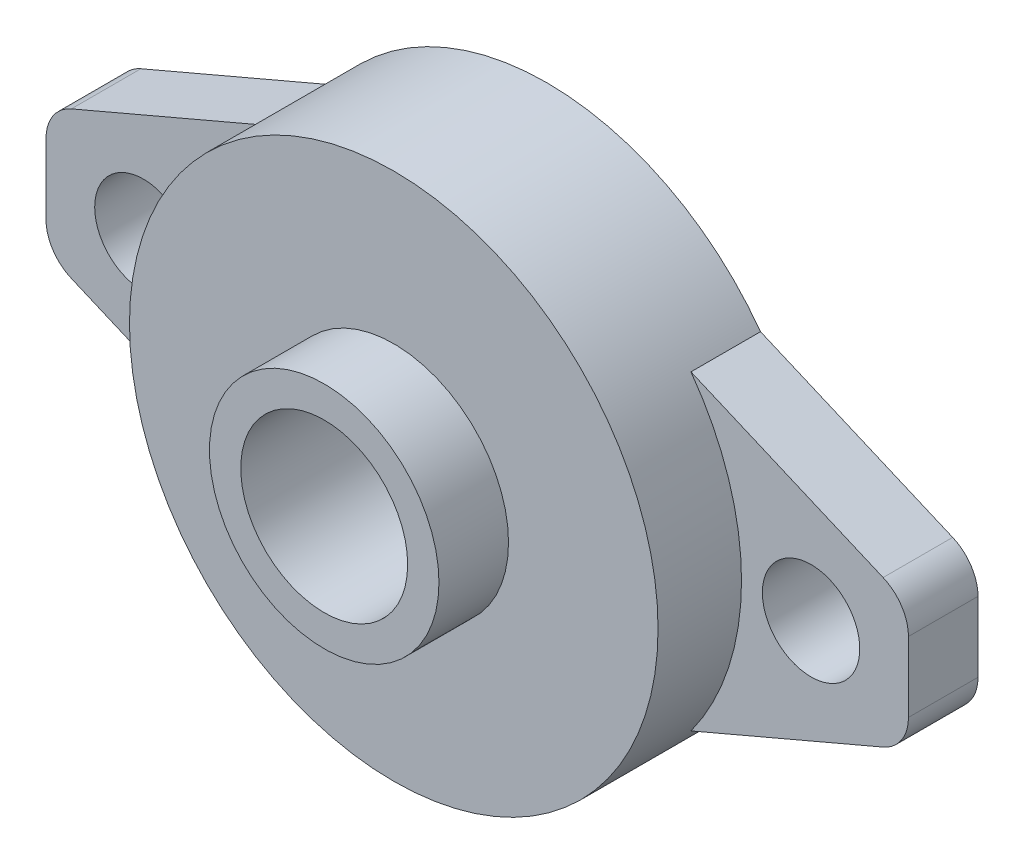
from build123d import *

# Parameters (mm, degrees)
SKETCH1_R           = 19
SKETCH1_R_2         = 6
BOSS_EXTRUDE1_DEPTH = 11
SKETCH2_R           = 8.25
SKETCH2_R_2         = 6
BOSS_EXTRUDE2_DEPTH = 5
SKETCH3_R           = 3.5
BOSS_EXTRUDE3_DEPTH = 5
FILLET1_R           = 3


with BuildPart() as part:
    # Sketch1 → Boss-Extrude1 (new body)
    with BuildSketch(Plane.XY):
        Circle(SKETCH1_R)
        Circle(SKETCH1_R_2, mode=Mode.SUBTRACT)
    extrude(amount=BOSS_EXTRUDE1_DEPTH)

    # Sketch2 → Boss-Extrude2 (add)
    with BuildSketch(Plane.XY.offset(11)):
        Circle(SKETCH2_R)
        Circle(SKETCH2_R_2, mode=Mode.SUBTRACT)
    extrude(amount=BOSS_EXTRUDE2_DEPTH)

    # Sketch3 → Boss-Extrude3 (add)
    # profile 1 of 2: a face of its own
    with BuildSketch(Plane(origin=(0, 0, 0), x_dir=(-1, 0, 0), z_dir=(0, 0, -1))):
        with BuildLine():
            Line((31, 4.5), (31, -4.5))
            Line((31, -4.5), (15.364682716, -11.177053505))
            ThreePointArc((15.364682716, -11.177053505), (19, 0), (15.364682716, 11.177053505))
            Line((15.364682716, 11.177053505), (31, 4.5))
        make_face()
        with Locations((24, 0)):
            Circle(SKETCH3_R, mode=Mode.SUBTRACT)
    # profile 2 of 2: a face of its own
    with BuildSketch(Plane(origin=(0, 0, 0), x_dir=(-1, 0, 0), z_dir=(0, 0, -1))):
        with BuildLine():
            Line((-15.364682716, -11.177053505), (-31, -4.5))
            Line((-31, -4.5), (-31, 4.5))
            Line((-31, 4.5), (-15.364682716, 11.177053505))
            ThreePointArc((-15.364682716, 11.177053505), (-19, 0), (-15.364682716, -11.177053505))
        make_face()
        with Locations((-24, 0)):
            Circle(SKETCH3_R, mode=Mode.SUBTRACT)
    extrude(amount=-BOSS_EXTRUDE3_DEPTH)

    # Fillet1
    fillet1_edges = [part.edges().sort_by_distance(p)[0] for p in [
        (31, -4.5, 2.5),
        (31, 4.5, 2.5),
        (-31, -4.5, 2.5),
        (-31, 4.5, 2.5),
    ]]
    fillet(fillet1_edges, radius=FILLET1_R)


solid = part.part
